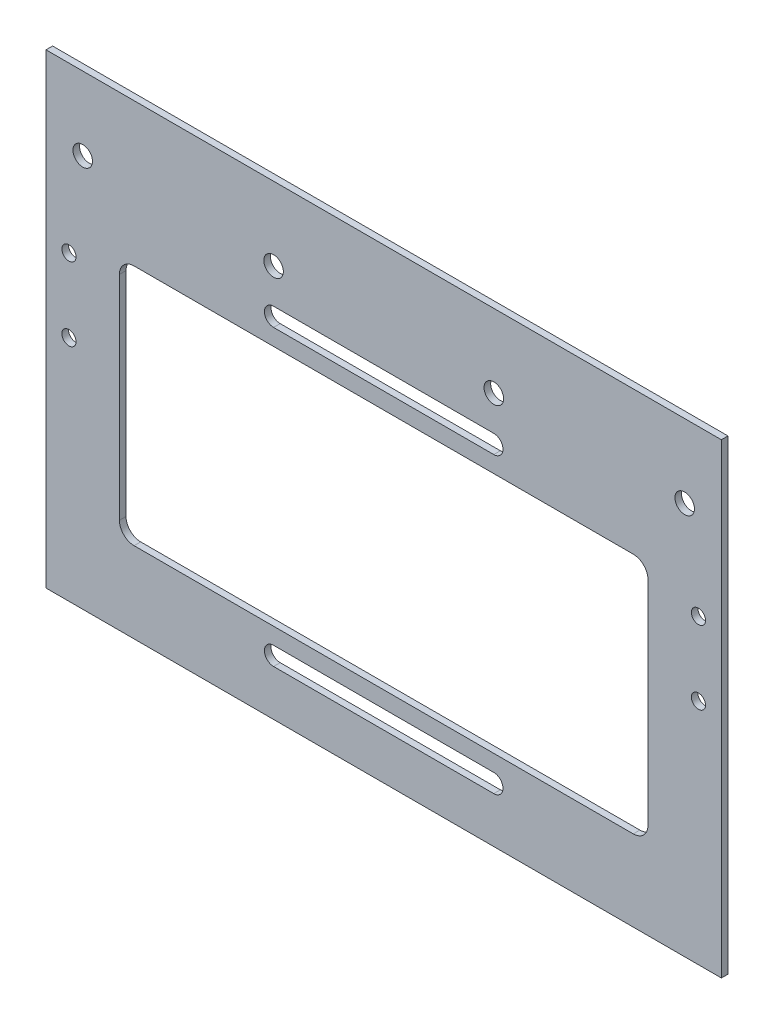
from build123d import *

# Parameters (mm, degrees)
SKETCH1_W                    = 233.68
SKETCH1_H                    = 161.29
BOSS_EXTRUDE1_DEPTH          = 2.286
CUT_EXTRUDE1_DEPTH           = 142.987419939
F_1_4_CLEARANCE_HOLE1_D      = 6.7564
F_1_4_CLEARANCE_HOLE2_D      = 6.7564
F_10_0_1935_DIAMETER_HOLE1_D = 4.9149


with BuildPart() as part:
    # Sketch1 → Boss-Extrude1 (new body)
    with BuildSketch(Plane.XY):
        Rectangle(SKETCH1_W, SKETCH1_H)
        with BuildLine():
            Line((-86.36, 31.115), (86.36, 31.115))
            ThreePointArc((86.36, 31.115), (89.952102448, 29.627102448), (91.44, 26.035))
            Line((91.44, 26.035), (91.44, -47.625))
            ThreePointArc((91.44, -47.625), (89.952102448, -51.217102448), (86.36, -52.705))
            Line((86.36, -52.705), (-86.36, -52.705))
            ThreePointArc((-86.36, -52.705), (-89.952102448, -51.217102448), (-91.44, -47.625))
            Line((-91.44, -47.625), (-91.44, 26.035))
            ThreePointArc((-91.44, 26.035), (-89.952102448, 29.627102448), (-86.36, 31.115))
        make_face(mode=Mode.SUBTRACT)
    extrude(amount=BOSS_EXTRUDE1_DEPTH)

    # Sketch2 → Cut-Extrude1 (cut, through all)
    with BuildSketch(Plane.XY.offset(2.286)):
        with BuildLine():
            Line((38.1, 36.83), (-38.1, 36.83))
            ThreePointArc((-38.1, 36.83), (-41.275, 40.005), (-38.1, 43.18))
            Line((-38.1, 43.18), (38.1, 43.18))
            ThreePointArc((38.1, 43.18), (41.275, 40.005), (38.1, 36.83))
        make_face()
        with BuildLine():
            Line((38.1, -58.42), (-38.1, -58.42))
            ThreePointArc((-38.1, -58.42), (-41.275, -61.595), (-38.1, -64.77))
            Line((-38.1, -64.77), (38.1, -64.77))
            ThreePointArc((38.1, -64.77), (41.275, -61.595), (38.1, -58.42))
        make_face()
    extrude(amount=-CUT_EXTRUDE1_DEPTH, mode=Mode.SUBTRACT)

    # 1/4 Clearance Hole1 (through all)
    with Locations(Plane.XY.offset(2.286)):
        with Locations((-38.1, 55.245), (38.1, 55.245)):
            Hole(F_1_4_CLEARANCE_HOLE1_D / 2)

    # 1/4 Clearance Hole2 (through all)
    with Locations(Plane.XY.offset(2.286)):
        with Locations((-104.14, 55.245), (104.14, 55.245)):
            Hole(F_1_4_CLEARANCE_HOLE2_D / 2)

    # #10 (0.1935) Diameter Hole1 (through all)
    with Locations(Plane.XY.offset(2.286)):
        with Locations((-108.9025, 23.749), (-108.9025, -1.651)):
            f_10_0_1935_diameter_hole1 = Hole(F_10_0_1935_DIAMETER_HOLE1_D / 2)

    # Mirror1: #10 (0.1935) Diameter Hole1 across plane
    add(f_10_0_1935_diameter_hole1.mirror(Plane(origin=(0, 0, 0), x_dir=(0, 0, 1), z_dir=(1, 0, 0))), mode=Mode.SUBTRACT)


solid = part.part
